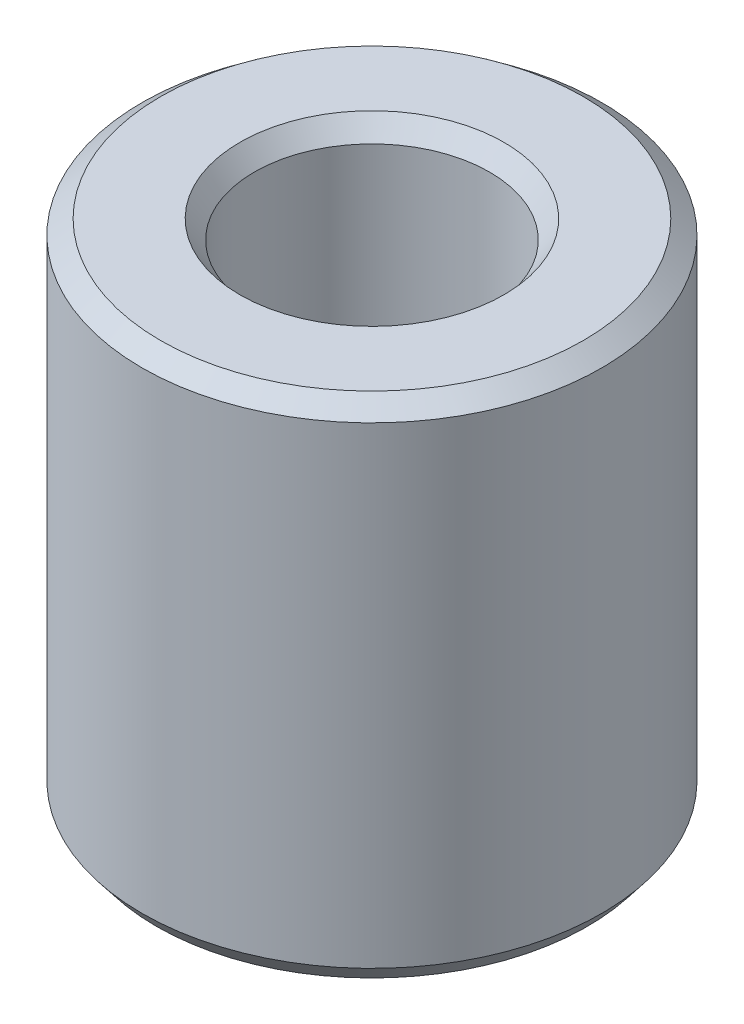
from build123d import *
from OCP.BRepFilletAPI import BRepFilletAPI_MakeChamfer

# Parameters (mm, degrees)
SKETCH1_R           = 5
BOSS_EXTRUDE1_DEPTH = 10.992936622
SKETCH2_R           = 2.559262804
CUT_EXTRUDE1_DEPTH  = 14.070755738
CHAMFER1_SIZE       = 0.313822091
CHAMFER1_SIZE2      = 0.403020658


with BuildPart() as part:
    # Sketch1 → Boss-Extrude1 (new body)
    with BuildSketch(Plane(origin=(0, 0, 0), x_dir=(1, 0, 0), z_dir=(0, 1, 0))):
        Circle(SKETCH1_R)
    extrude(amount=BOSS_EXTRUDE1_DEPTH)

    # Sketch2 → Cut-Extrude1 (cut, through all)
    with BuildSketch(Plane(origin=(0, 0, 0), x_dir=(1, 0, 0), z_dir=(0, 1, 0))):
        Circle(SKETCH2_R)
    extrude(amount=CUT_EXTRUDE1_DEPTH, mode=Mode.SUBTRACT)

    # Chamfer1: one chamfer whose edges measure the first distance from different faces: ONE call of the kernel's chamfer builder (chamfer() names one face for all edges)
    chamfer1_edges_1 = [part.edges().sort_by_distance(p)[0] for p in [
        (-2.559262804, 10.992936622, 0),
    ]]
    chamfer1_side_1 = [part.faces().sort_by_distance(p)[0] for p in [
        (-4.858578644, 10.992936622, 0),
    ]]
    chamfer1_edges_2 = [part.edges().sort_by_distance(p)[0] for p in [
        (-2.559262804, 0, 0),
    ]]
    chamfer1_side_2 = [part.faces().sort_by_distance(p)[0] for p in [
        (-2.559262804, 5.496468311, 0),
    ]]
    chamfer1_edges_3 = [part.edges().sort_by_distance(p)[0] for p in [
        (-5, 0, 0),
    ]]
    chamfer1_side_3 = [part.faces().sort_by_distance(p)[0] for p in [
        (-4.858578644, 0, 0),
    ]]
    chamfer1_edges_4 = [part.edges().sort_by_distance(p)[0] for p in [
        (-5, 10.992936622, 0),
    ]]
    chamfer1_side_4 = [part.faces().sort_by_distance(p)[0] for p in [
        (-5, 5.496468311, 0),
    ]]
    chamfer1 = BRepFilletAPI_MakeChamfer(part.part.solid().wrapped)
    for e in chamfer1_edges_1:
        chamfer1.Add(CHAMFER1_SIZE, CHAMFER1_SIZE2, e.wrapped, chamfer1_side_1[0].wrapped)  # the first distance lies on this face
    for e in chamfer1_edges_2:
        chamfer1.Add(CHAMFER1_SIZE, CHAMFER1_SIZE2, e.wrapped, chamfer1_side_2[0].wrapped)  # the first distance lies on this face
    for e in chamfer1_edges_3:
        chamfer1.Add(CHAMFER1_SIZE, CHAMFER1_SIZE2, e.wrapped, chamfer1_side_3[0].wrapped)  # the first distance lies on this face
    for e in chamfer1_edges_4:
        chamfer1.Add(CHAMFER1_SIZE, CHAMFER1_SIZE2, e.wrapped, chamfer1_side_4[0].wrapped)  # the first distance lies on this face
    add(Compound.cast(chamfer1.Shape()), mode=Mode.REPLACE)


solid = part.part
